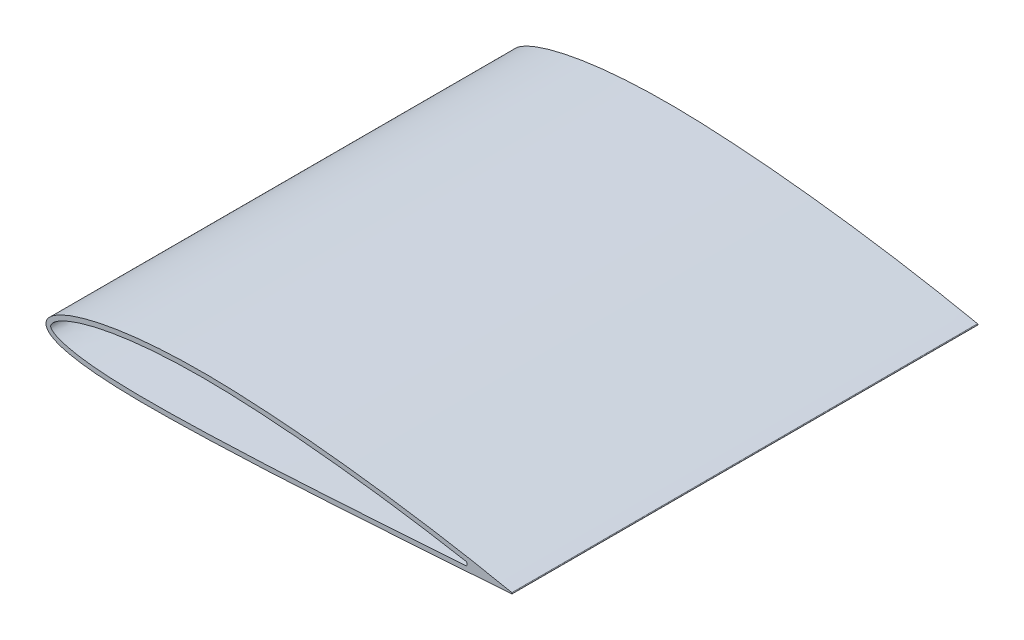
from build123d import *

# Parameters (mm, degrees)
SKIN_DEPTH         = 50
SKIN_DEPTH_BACK    = 50
CUT_EXTRUDE8_DEPTH = 142.720443872


with BuildPart() as part:
    # Sketch5 → Skin (new, two sides: drawn at the far end of the back side and taken through both)
    with BuildSketch(Plane.XY.offset(-SKIN_DEPTH_BACK)):
        with BuildLine():
            ThreePointArc((100.0084, 0.1257), (100.10930912, -0.007304667), (99.9916, -0.1257))
            add(Edge.make_bspline(
                [(100.0084, 0.1257), (99.957500642, 0.136303082), (99.754192016, 0.178655246), (99.297876957, 0.273366979), (98.540283019, 0.429255228), (97.48572544, 0.643248232), (96.140433343, 0.911804494), (94.512174409, 1.229920611), (92.61050912, 1.592108342), (90.446634039, 1.992481752), (88.033287643, 2.424225239), (85.384889545, 2.880615025), (82.517218884, 3.354743307), (79.447479742, 3.839313712), (76.194177925, 4.327196772), (71.550343584, 4.985213068), (66.727594221, 5.60405915), (61.75575792, 6.17071888), (57.90046179, 6.569527639), (53.993731703, 6.930532702), (50.059836075, 7.24644778), (46.123393413, 7.512109415), (42.204594298, 7.721234363), (38.322240069, 7.871105888), (34.500247404, 7.93415918), (30.768319544, 7.909896753), (27.156811486, 7.797759334), (23.689596336, 7.59910508), (20.389609152, 7.316887879), (17.278500701, 6.956072034), (14.376602932, 6.522713813), (11.702521534, 6.024481177), (9.27317557, 5.469822434), (7.103230609, 4.868679529), (5.205528837, 4.230336532), (3.590102816, 3.564933494), (2.264485051, 2.881327397), (1.231980783, 2.186303834), (0.493177741, 1.481313193), (0.048552271, 0.752337562), (-0.057013659, -0.005710418), (0.196243247, -0.727199534), (0.77177131, -1.354448911), (1.625699111, -1.903674748), (2.757747681, -2.39272268), (4.166022884, -2.82408904), (5.844628738, -3.198260062), (7.784387391, -3.51428429), (9.973883851, -3.771877849), (12.399983944, -3.971454399), (15.048218058, -4.114698543), (17.902995545, -4.203894752), (20.947675621, -4.242758965), (24.164727991, -4.235509815), (27.535735034, -4.187899091), (31.041497437, -4.105727243), (34.662064355, -3.996126226), (38.382526679, -3.864871097), (42.185945878, -3.721124547), (46.048922753, -3.547292037), (49.942439349, -3.352074562), (53.838417953, -3.139726448), (57.713216927, -2.91628127), (61.543176447, -2.685801733), (65.304797526, -2.452787618), (68.974883177, -2.220224199), (72.530754132, -1.991384635), (75.950306654, -1.768720114), (79.212193783, -1.554115096), (82.295931724, -1.349542232), (85.1821198, -1.156089623), (87.85249372, -0.97568909), (90.290086358, -0.809239476), (92.479319659, -0.658331336), (94.406178976, -0.524051336), (96.05826512, -0.407682957), (97.424894876, -0.310661926), (98.497178902, -0.233770416), (99.268146501, -0.178282012), (99.732734131, -0.144510967), (99.939766659, -0.129466565), (99.9916, -0.1257)],
                knots=[0, 0, 0, 0, 0.000764172, 0.003052354, 0.006849806, 0.012132473, 0.018867992, 0.027012839, 0.036516812, 0.047320748, 0.059356871, 0.072550805, 0.086820052, 0.102077398, 0.118227703, 0.135170889, 0.171012918, 0.18968989, 0.20871821, 0.227978895, 0.247353901, 0.266722825, 0.285966043, 0.30503218, 0.323824437, 0.342143817, 0.359879711, 0.376925818, 0.393181853, 0.408552719, 0.422951453, 0.436298149, 0.448522824, 0.459565428, 0.469379445, 0.477933616, 0.485220338, 0.491267538, 0.496167824, 0.50013339, 0.503587222, 0.507040597, 0.511000028, 0.515876125, 0.521872239, 0.529071215, 0.537494991, 0.547131181, 0.557945451, 0.569889642, 0.582904388, 0.596921672, 0.611866369, 0.627656322, 0.64420424, 0.661417059, 0.679197208, 0.697442956, 0.716133923, 0.735139063, 0.75427754, 0.773432072, 0.792486537, 0.811323416, 0.82982615, 0.847880344, 0.865374073, 0.882198025, 0.89824695, 0.913420544, 0.927622056, 0.940762976, 0.952758838, 0.963532927, 0.973016418, 0.981148268, 0.987875252, 0.99315353, 0.996949037, 0.999236151, 1, 1, 1, 1], degree=3))
        make_face()
    extrude(amount=SKIN_DEPTH + SKIN_DEPTH_BACK)

    # Sketch14 → Cut-Extrude8 (cut, through all)
    with BuildSketch(Plane(origin=(0, 0, -50), x_dir=(-1, 0, 0), z_dir=(0, 0, -1))):
        with BuildLine():
            ThreePointArc((-90.115290693, 1.03396948), (-90.421675283, 0.644202853), (-90.225429768, 0.188925753))
            add(Edge.make_bspline(
                [(-90.225429768, 0.188925753), (-86.391727021, -0.074079483), (-78.723607532, -0.587537275), (-67.21912982, -1.336093641), (-55.715235357, -2.043820227), (-46.130128779, -2.561283828), (-38.461652814, -2.864682946), (-32.704161048, -3.062731252), (-26.953298398, -3.208271015), (-21.207981278, -3.261445898), (-15.476569369, -3.162528888), (-10.725752654, -2.872949056), (-7.449835773, -2.45962958), (-5.613141306, -2.125953514), (-4.265228751, -1.811541614), (-2.976104613, -1.407593591), (-1.795124661, -0.880663228), (-1.107585561, -0.288136625), (-0.979957435, 0.077620146), (-0.998172674, 0.41905175), (-1.484509449, 1.121249591), (-2.523853708, 1.87082828), (-3.702192887, 2.507358441), (-5.384549105, 3.239757638), (-7.59682353, 3.987124105), (-10.330273911, 4.70412481), (-13.109368433, 5.284335089), (-16.853402723, 5.909848724), (-21.580944843, 6.458596443), (-27.289763423, 6.827393503), (-33.016740804, 6.955250435), (-38.746322059, 6.873750147), (-46.396103706, 6.528555519), (-55.948947375, 5.808676084), (-67.382503041, 4.557781809), (-78.777970453, 2.979412789), (-86.342842876, 1.718665877), (-90.115290693, 1.03396948)],
                knots=[0.047629743, 0.047629743, 0.047629743, 0.047629743, 0.104122253, 0.160614763, 0.217107273, 0.273599783, 0.301846038, 0.330092293, 0.358338548, 0.386584803, 0.414831058, 0.443077313, 0.457200441, 0.464262005, 0.471323568, 0.478385132, 0.485446696, 0.49250826, 0.496039042, 0.499569823, 0.506631387, 0.513692951, 0.520754515, 0.527816078, 0.541939206, 0.556062333, 0.570185461, 0.584308588, 0.612554843, 0.640801098, 0.669047353, 0.697293608, 0.725539864, 0.782032374, 0.838524884, 0.895017394, 0.951509904, 0.951509904, 0.951509904, 0.951509904], degree=3))
        make_face()
    extrude(amount=-CUT_EXTRUDE8_DEPTH, mode=Mode.SUBTRACT)


solid = part.part
